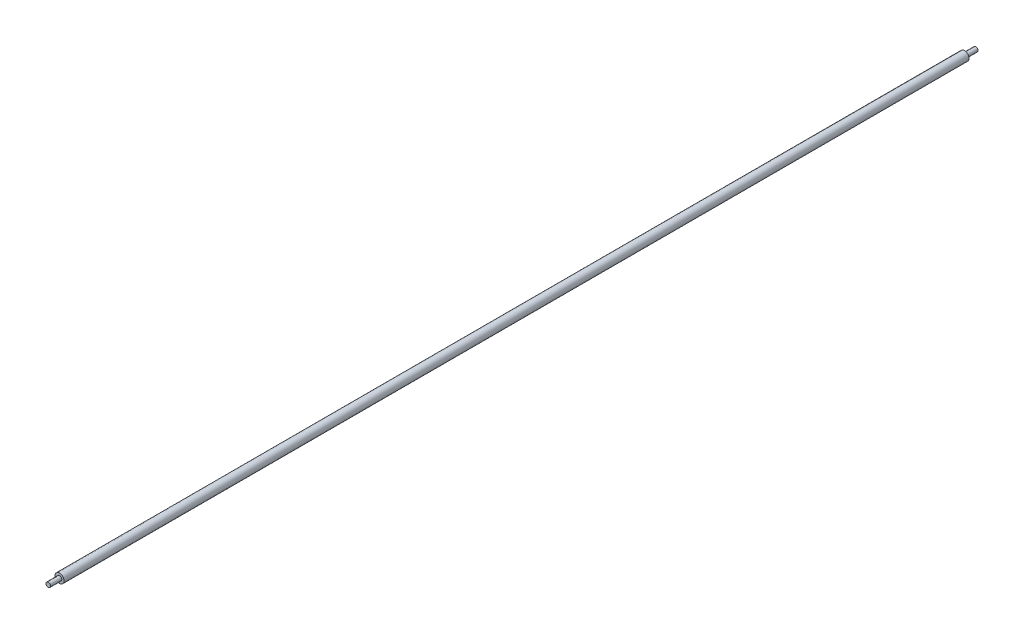
from build123d import *

# Parameters (mm, degrees)
SKETCH1_R           = 5.08
BOSS_EXTRUDE2_DEPTH = 1020
SKETCH2_R           = 2.54
BOSS_EXTRUDE3_DEPTH = 12.7
BOSS_EXTRUDE4_START = 12.7
SKETCH3_R           = 2.54
BOSS_EXTRUDE4_DEPTH = 12.7


with BuildPart() as part:
    # Sketch1 → Boss-Extrude2 (new body)
    with BuildSketch(Plane.XY):
        Circle(SKETCH1_R)
    extrude(amount=BOSS_EXTRUDE2_DEPTH)

    # Sketch2 → Boss-Extrude3 (add)
    with BuildSketch(Plane.XY.offset(1020)):
        Circle(SKETCH2_R)
    extrude(amount=BOSS_EXTRUDE3_DEPTH)

    # Sketch3 → Boss-Extrude4 (add)
    with BuildSketch(Plane(origin=(0, 0, 0), x_dir=(-1, 0, 0), z_dir=(0, 0, -1)).offset(BOSS_EXTRUDE4_START)):
        Circle(SKETCH3_R)
    extrude(amount=-BOSS_EXTRUDE4_DEPTH)


solid = part.part
